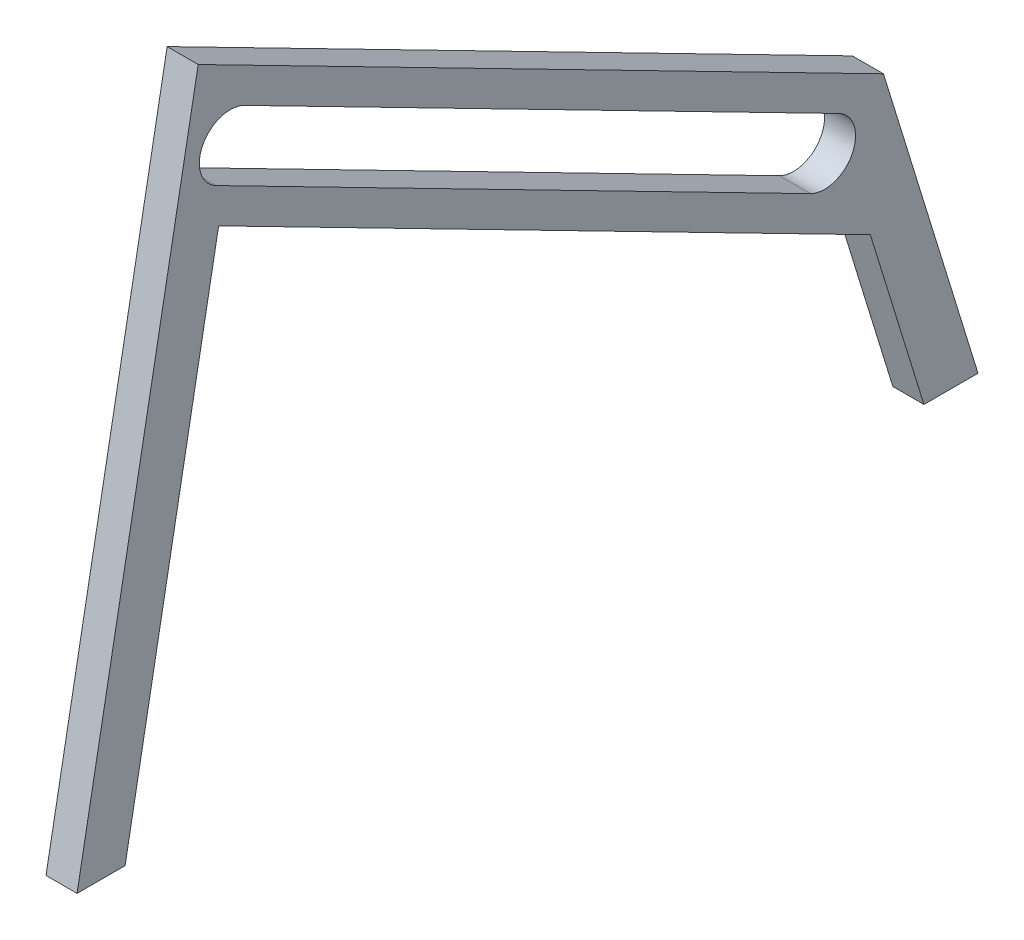
from build123d import *

# Parameters (mm, degrees)
BOSS_EXTRUDE1_DEPTH = 12.7


with BuildPart() as part:
    # Sketch1 → Boss-Extrude1 (new body)
    with BuildSketch(Plane(origin=(0, 0, 0), x_dir=(0, 0, -1), z_dir=(1, 0, 0))):
        Polygon((-394.946506416, 268.859), (-444.5, 0), (-424.843977237, 0), (-386.595946056, 207.51972609), (-277.942198287, 151.915105422), (-120.014982237, 71.094304281), (-98.092418556, 0), (-75.979077973, 0), (-114.652094185, 125.415586519), align=None)
        with BuildLine():
            Line((-376.004593209, 244.898842015), (-132.968224737, 120.522597707))
            ThreePointArc((-132.968224737, 120.522597707), (-127.448402275, 103.431326251), (-144.539673731, 97.911503788))
            Line((-144.539673731, 97.911503788), (-387.576042203, 222.287748096))
            ThreePointArc((-387.576042203, 222.287748096), (-393.095864665, 239.379019552), (-376.004593209, 244.898842015))
        make_face(mode=Mode.SUBTRACT)
    extrude(amount=BOSS_EXTRUDE1_DEPTH)


solid = part.part
